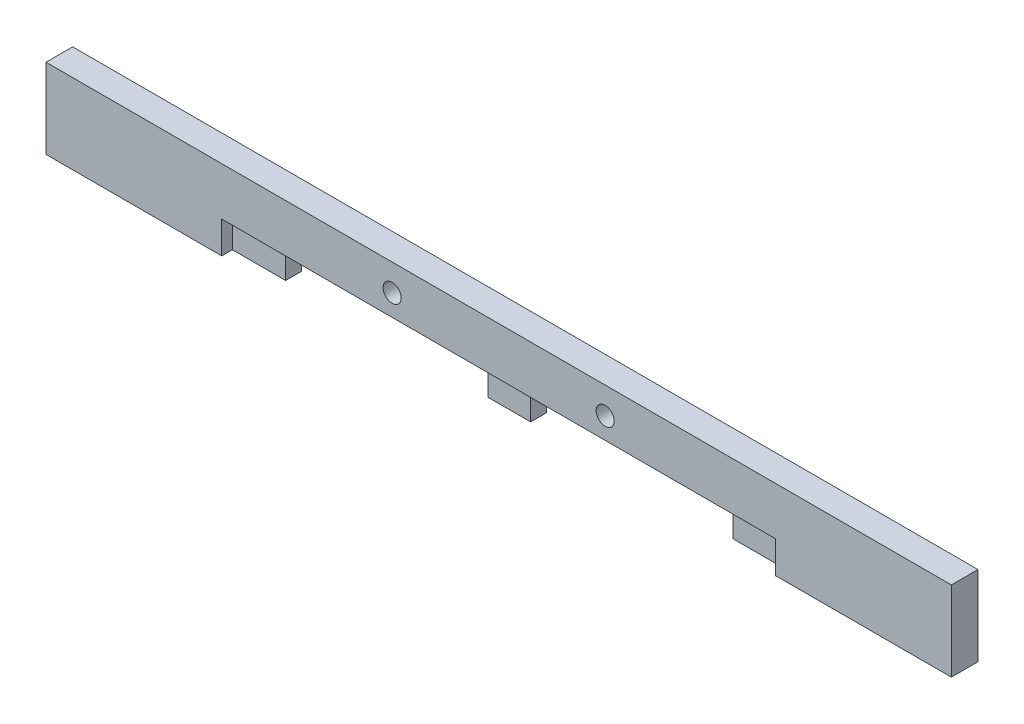
from build123d import *

# Parameters (mm, degrees)
SZKIC1_W                    = 170
SZKIC1_H                    = 20
DODANIE_WYCI_GNI_CIE1_DEPTH = 5
GNIAZDO1_START              = 3
GNIAZDO1_OUTLINE_W          = 100
GNIAZDO1_OUTLINE_H          = 10
GNIAZDO1_DEPTH              = 1
GNIAZDO1_START_2            = 4
GNIAZDO1_2_OUTLINE_W        = 100
GNIAZDO1_2_OUTLINE_H        = 1
GNIAZDO1_2_DEPTH            = 1
SZKIC2_W                    = 100
SZKIC2_H                    = 10
WYTNIJ_WYCI_GNI_CIE1_DEPTH  = 10
SZKIC3_W                    = 2
SZKIC3_H                    = 10
WYTNIJ_WYCI_GNI_CIE2_DEPTH  = 2
SZKIC4_W                    = 2
SZKIC4_H                    = 10
WYTNIJ_WYCI_GNI_CIE3_DEPTH  = 2
SZKIC5_W                    = 104
SZKIC5_H                    = 2
WYTNIJ_WYCI_GNI_CIE4_DEPTH  = 1
SZKIC6_R                    = 1.7
WYTNIJ_WYCI_GNI_CIE5_DEPTH  = 10
WYTNIJ_WYCI_GNI_CIE6_DEPTH  = 5
SZKIC8_W                    = 38
SZKIC8_H                    = 6
WYTNIJ_WYCI_GNI_CIE7_DEPTH  = 10


# Read off the part's stored shape, not the designer's step: Gniazdo1
with BuildPart() as part:
    # Szkic1 → Dodanie-wyciągnięcie1 (new body)
    with BuildSketch(Plane.XY):
        with Locations((-52.199192033, 33.239845261)):
            Rectangle(SZKIC1_W, SZKIC1_H)
    extrude(amount=DODANIE_WYCI_GNI_CIE1_DEPTH)

    # Gniazdo1 outline → Gniazdo1 (cut)
    with BuildSketch(Plane.XY.offset(GNIAZDO1_START)):
        with Locations((-52.199192033, 28.239845261)):
            Rectangle(GNIAZDO1_OUTLINE_W, GNIAZDO1_OUTLINE_H)
    extrude(amount=GNIAZDO1_DEPTH, mode=Mode.SUBTRACT)

    # Gniazdo1 2 outline → Gniazdo1 2 (cut)
    with BuildSketch(Plane.XY.offset(GNIAZDO1_START_2)):
        with Locations((-52.199192033, 32.739845261)):
            Rectangle(GNIAZDO1_2_OUTLINE_W, GNIAZDO1_2_OUTLINE_H)
    extrude(amount=GNIAZDO1_2_DEPTH, mode=Mode.SUBTRACT)

    # Szkic2 → Wytnij-wyciągnięcie1 (cut)
    with BuildSketch(Plane.XY.offset(3)):
        with Locations((-52.199192033, 28.239845261)):
            Rectangle(SZKIC2_W, SZKIC2_H)
    extrude(amount=WYTNIJ_WYCI_GNI_CIE1_DEPTH, mode=Mode.SUBTRACT)

    # Szkic3 → Wytnij-wyciągnięcie2 (cut)
    with BuildSketch(Plane(origin=(-102.199192033, 0, 0), x_dir=(0, 0, -1), z_dir=(1, 0, 0))):
        with Locations((-4, 28.239845261)):
            Rectangle(SZKIC3_W, SZKIC3_H)
    extrude(amount=-WYTNIJ_WYCI_GNI_CIE2_DEPTH, mode=Mode.SUBTRACT)

    # Szkic4 → Wytnij-wyciągnięcie3 (cut)
    with BuildSketch(Plane.ZY.offset(2.199192033)):
        with Locations((4, 28.239845261)):
            Rectangle(SZKIC4_W, SZKIC4_H)
    extrude(amount=-WYTNIJ_WYCI_GNI_CIE3_DEPTH, mode=Mode.SUBTRACT)

    # Szkic5 → Wytnij-wyciągnięcie4 (cut)
    with BuildSketch(Plane.XZ.offset(-33.239845261)):
        with Locations((-52.199192033, 4)):
            Rectangle(SZKIC5_W, SZKIC5_H)
    extrude(amount=-WYTNIJ_WYCI_GNI_CIE4_DEPTH, mode=Mode.SUBTRACT)

    # Szkic6 → Wytnij-wyciągnięcie5 (cut)
    with BuildSketch(Plane(origin=(0, 0, 0), x_dir=(-1, 0, 0), z_dir=(0, 0, -1))):
        with Locations((72.199192033, 38.239845261)):
            Circle(SZKIC6_R)
        with Locations((32.199192033, 38.239845261)):
            Circle(SZKIC6_R)
    extrude(amount=-WYTNIJ_WYCI_GNI_CIE5_DEPTH, mode=Mode.SUBTRACT)

    # Szkic7 → Wytnij-wyciągnięcie6 (cut)
    with BuildSketch(Plane.XZ.offset(-23.239845261)):
        Polygon((-0.199192033, 3), (-104.199192033, 3), (-104.199192033, 5), (-137.199192033, 5), (-137.199192033, 3), (-137.653937347, 3), (-137.653937347, 0), (-0.199192033, 0), (33.231073198, 0), (33.231073198, 3), (33.231073198, 5), (-0.199192033, 5), align=None)
    extrude(amount=-WYTNIJ_WYCI_GNI_CIE6_DEPTH, mode=Mode.SUBTRACT)

    # Szkic8 → Wytnij-wyciągnięcie7 (cut)
    with BuildSketch(Plane.XY.offset(3)):
        with Locations((-75.199192033, 31.239845261)):
            Rectangle(SZKIC8_W, SZKIC8_H)
        with Locations((-29.199192033, 31.239845261)):
            Rectangle(SZKIC8_W, SZKIC8_H)
    extrude(amount=-WYTNIJ_WYCI_GNI_CIE7_DEPTH, mode=Mode.SUBTRACT)


solid = part.part
